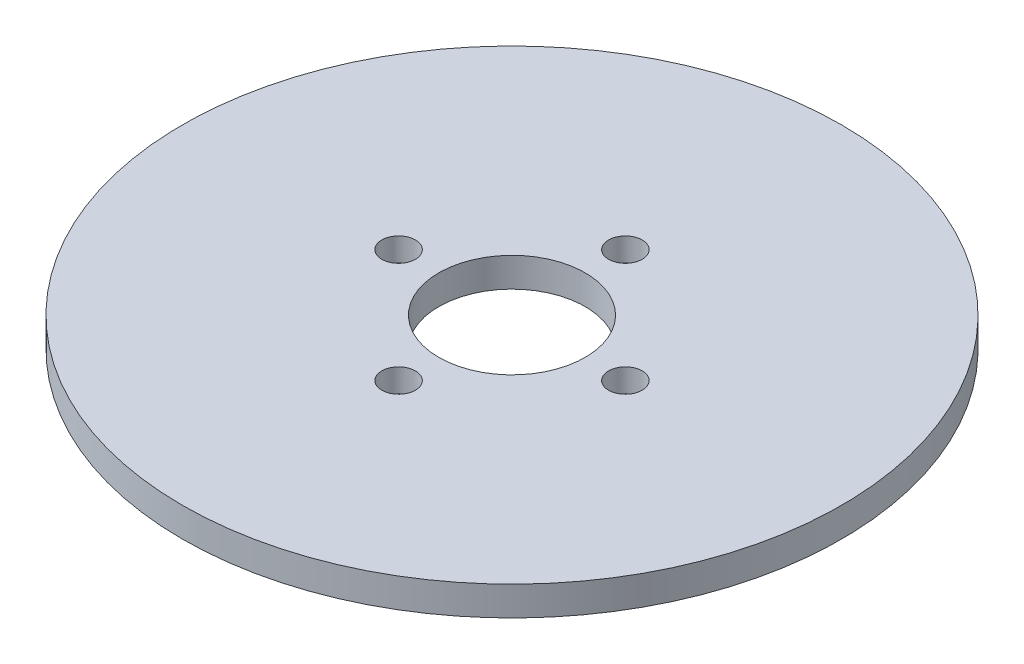
from build123d import *

# Parameters (mm, degrees)
SKETCH1_R           = 45
BOSS_EXTRUDE1_DEPTH = 4
SKETCH2_R           = 10
CUT_EXTRUDE1_DEPTH  = 64.765194268
SKETCH3_R           = 2.294197772
CUT_EXTRUDE2_DEPTH  = 3.180167202
CIRPATTERN1_COUNT   = 4


with BuildPart() as part:
    # Sketch1 → Boss-Extrude1 (new body)
    with BuildSketch(Plane(origin=(0, 0, 0), x_dir=(1, 0, 0), z_dir=(0, 1, 0))):
        Circle(SKETCH1_R)
    extrude(amount=BOSS_EXTRUDE1_DEPTH)

    # Sketch2 → Cut-Extrude1 (cut, through all)
    with BuildSketch(Plane(origin=(0, 0, 0), x_dir=(1, 0, 0), z_dir=(0, 1, 0))):
        Circle(SKETCH2_R)
    extrude(amount=CUT_EXTRUDE1_DEPTH, mode=Mode.SUBTRACT)

    # Sketch3 → Cut-Extrude2 (cut)
    with BuildSketch(Plane(origin=(0, 4, 0), x_dir=(1, 0, 0), z_dir=(0, 1, 0))):
        with Locations((-15.482628795, 0)):
            Circle(SKETCH3_R)
    cut_extrude2 = extrude(amount=-CUT_EXTRUDE2_DEPTH, mode=Mode.SUBTRACT)

    # CirPattern1: Cut-Extrude2 ×4 about axis
    cirpattern1_axis = Axis((0, 0, 0), (0, 1, 0))
    for i in range(1, CIRPATTERN1_COUNT):
        add(cut_extrude2.rotate(cirpattern1_axis, i * 360 / CIRPATTERN1_COUNT), mode=Mode.SUBTRACT)


solid = part.part
